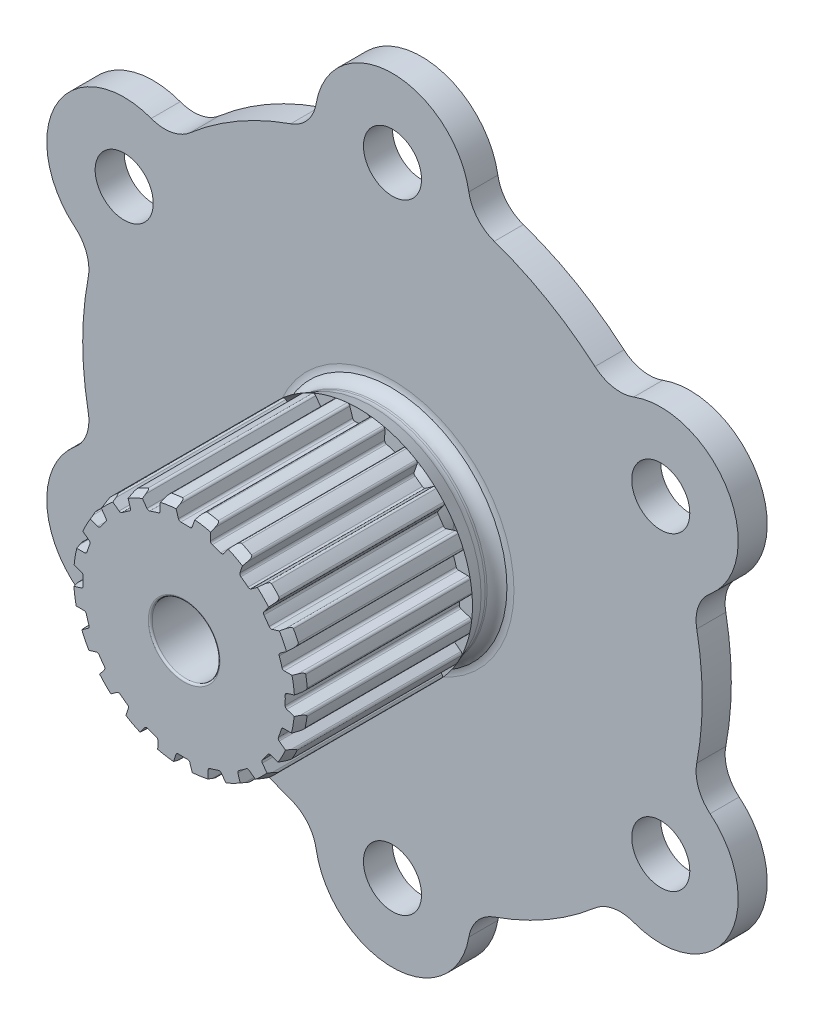
from build123d import *

# Parameters (mm, degrees)
SKETCH1_R           = 3
BOSS_EXTRUDE1_DEPTH = 3
FILLET3_R           = 4
SKETCH13_R          = 23.95
SKETCH13_R_2        = 20.95
BOSS_EXTRUDE8_DEPTH = 4
CHAMFER4_SIZE       = 1
BOSS_EXTRUDE9_DEPTH = 18
SKETCH24_W          = 1
SKETCH24_H          = 1
FILLET5_R           = 0.5
FILLET6_R           = 0.5
FILLET7_R           = 2
SKETCH25_R          = 3.5
CUT_EXTRUDE1_DEPTH  = 61.736209152
FILLET8_R           = 0.2
FILLET9_R           = 1


# Some blends are built 0.0001 mm under size
with BuildPart() as part:
    # Sketch1 → Boss-Extrude1 (new body)
    with BuildSketch(Plane.XY):
        with BuildLine():
            ThreePointArc((-7.937253933, 31), (-16, 27.712812921), (-22.878160551, 22.373863542))
            ThreePointArc((-22.878160551, 22.373863542), (-34.641016151, 20), (-30.815414484, 8.626136458))
            ThreePointArc((-30.815414484, 8.626136458), (-32, 0), (-30.815414484, -8.626136458))
            ThreePointArc((-30.815414484, -8.626136458), (-34.641016151, -20), (-22.878160551, -22.373863542))
            ThreePointArc((-22.878160551, -22.373863542), (-16, -27.712812921), (-7.937253933, -31))
            ThreePointArc((-7.937253933, -31), (0, -40), (7.937253933, -31))
            ThreePointArc((7.937253933, -31), (16, -27.712812921), (22.878160551, -22.373863542))
            ThreePointArc((22.878160551, -22.373863542), (34.641016151, -20), (30.815414484, -8.626136458))
            ThreePointArc((30.815414484, -8.626136458), (32, 0), (30.815414484, 8.626136458))
            ThreePointArc((30.815414484, 8.626136458), (34.641016151, 20), (22.878160551, 22.373863542))
            ThreePointArc((22.878160551, 22.373863542), (16, 27.712812921), (7.937253933, 31))
            ThreePointArc((7.937253933, 31), (0, 40), (-7.937253933, 31))
        make_face()
        with Locations((0, 32)):
            Circle(SKETCH1_R, mode=Mode.SUBTRACT)
        with Locations((27.712812921, 16)):
            Circle(SKETCH1_R, mode=Mode.SUBTRACT)
        with Locations((27.712812921, -16)):
            Circle(SKETCH1_R, mode=Mode.SUBTRACT)
        with Locations((0, -32)):
            Circle(SKETCH1_R, mode=Mode.SUBTRACT)
        with Locations((-27.712812921, -16)):
            Circle(SKETCH1_R, mode=Mode.SUBTRACT)
        with Locations((-27.712812921, 16)):
            Circle(SKETCH1_R, mode=Mode.SUBTRACT)
    extrude(amount=BOSS_EXTRUDE1_DEPTH)

    # Fillet3
    fillet3_edges = [part.edges().sort_by_distance(p)[0] for p in [
        (30.815414484, 8.626136458, 1.5),
        (30.815414484, -8.626136458, 1.5),
        (22.878160551, -22.373863542, 1.5),
        (7.937253933, -31, 1.5),
        (-7.937253933, -31, 1.5),
        (-22.878160551, -22.373863542, 1.5),
        (-30.815414484, -8.626136458, 1.5),
        (-30.815414484, 8.626136458, 1.5),
        (-22.878160551, 22.373863542, 1.5),
        (-7.937253933, 31, 1.5),
        (7.937253933, 31, 1.5),
        (22.878160551, 22.373863542, 1.5),
    ]]
    fillet(fillet3_edges, radius=FILLET3_R)

    # Sketch13 → Boss-Extrude8 (add)
    with BuildSketch(Plane(origin=(0, 0, 0), x_dir=(-1, 0, 0), z_dir=(0, 0, -1))):
        with Locations(Location((0, 0, 0), (0, 0, 180))):
            Circle(SKETCH13_R)
        Circle(SKETCH13_R_2, mode=Mode.SUBTRACT)
    extrude(amount=BOSS_EXTRUDE8_DEPTH)

    # Chamfer4
    chamfer4_edges = [part.edges().sort_by_distance(p)[0] for p in [
        (-23.95, 0, -4),
    ]]
    chamfer(chamfer4_edges, length=CHAMFER4_SIZE)

    # Sketch22 → Revolve1 (revolve)
    with BuildSketch(Plane(origin=(0, 0, 0), x_dir=(0, 0, -1), z_dir=(1, 0, 0)), mode=Mode.PRIVATE) as revolve1_sk:
        with BuildLine():
            Line((-6.521607252, 11.78), (-6.521607252, 0))
            Line((-6.521607252, 0), (-3, 0))
            Line((-3, 0), (-3, 12.099713797))
            Line((-3, 12.099713797), (-3.1, 11.926508716))
            ThreePointArc((-3.1, 11.926508716), (-3.649038106, 11.377470611), (-4.399038106, 11.176508716))
            Line((-4.399038106, 11.176508716), (-4.599038106, 11.176508716))
            ThreePointArc((-4.599038106, 11.176508716), (-4.859510372, 11.199297087), (-5.112068321, 11.266969785))
            Line((-5.112068321, 11.266969785), (-6.521607252, 11.78))
        make_face()
    revolve(revolve1_sk.sketch.rotate(Axis((0, 0, 6.521607252), (0, 0, -1)), 90), axis=Axis((0, 0, 6.521607252), (0, 0, -1)))

    # Sketch23 → Boss-Extrude9 (add)
    with BuildSketch(Plane.XY.offset(6.521607252)):
        with BuildLine():
            Line((1.152037334, 11.522110646), (0.840979736, 10.601581719))
            ThreePointArc((0.840979736, 10.601581719), (0.742588975, 10.472458841), (0.586095184, 10.429294583))
            ThreePointArc((0.586095184, 10.429294583), (0.122277707, 10.445034285), (-0.341781129, 10.440157026))
            ThreePointArc((-0.341781129, 10.440157026), (-0.497221541, 10.486973028), (-0.592562526, 10.618363881))
            Line((-0.592562526, 10.618363881), (-0.881984971, 11.545922496))
            ThreePointArc((-0.881984971, 11.545922496), (-0.984130945, 11.681984497), (-1.14923697, 11.723053568))
            ThreePointArc((-1.14923697, 11.723053568), (-1.706364416, 11.655001117), (-2.259617701, 11.560486945))
            ThreePointArc((-2.259617701, 11.560486945), (-2.406021059, 11.473810969), (-2.464875387, 11.314177526))
            Line((-2.464875387, 11.314177526), (-2.47624966, 10.342580407))
            ThreePointArc((-2.47624966, 10.342580407), (-2.529923671, 10.189372835), (-2.665419621, 10.099961946))
            ThreePointArc((-2.665419621, 10.099961946), (-3.111400091, 9.97160381), (-3.551239115, 9.823563193))
            ThreePointArc((-3.551239115, 9.823563193), (-3.713538672, 9.820054129), (-3.844815343, 9.915552271))
            Line((-3.844815343, 9.915552271), (-4.406703821, 10.708276481))
            ThreePointArc((-4.406703821, 10.708276481), (-4.545895886, 10.806114292), (-4.715612088, 10.794152732))
            ThreePointArc((-4.715612088, 10.794152732), (-5.224442411, 10.557269157), (-5.721411068, 10.29641617))
            ThreePointArc((-5.721411068, 10.29641617), (-5.833864586, 10.168741293), (-5.840508932, 9.998733879))
            Line((-5.840508932, 9.998733879), (-5.551086487, 9.071175265))
            ThreePointArc((-5.551086487, 9.071175265), (-5.554789761, 8.908880023), (-5.656024583, 8.781974663))
            ThreePointArc((-5.656024583, 8.781974663), (-6.04051237, 8.522083276), (-6.413077073, 8.245370551))
            ThreePointArc((-6.413077073, 8.245370551), (-6.566348763, 8.191879911), (-6.720710846, 8.242137319))
            Line((-6.720710846, 8.242137319), (-7.500063797, 8.822429756))
            ThreePointArc((-7.500063797, 8.822429756), (-7.662676864, 8.87246633), (-7.820390238, 8.80864502))
            ThreePointArc((-7.820390238, 8.80864502), (-8.231115583, 8.426118135), (-8.623152856, 8.024460442))
            ThreePointArc((-8.623152856, 8.024460442), (-8.690648801, 7.868284369), (-8.644432769, 7.704544494))
            Line((-8.644432769, 7.704544494), (-8.082544291, 6.911820284))
            ThreePointArc((-8.082544291, 6.911820284), (-8.035914327, 6.756323962), (-8.092978451, 6.604346512))
            ThreePointArc((-8.092978451, 6.604346512), (-8.378337211, 6.238361855), (-8.647158365, 5.86006359))
            ThreePointArc((-8.647158365, 5.86006359), (-8.776398888, 5.761827411), (-8.938736346, 5.76192454))
            Line((-8.938736346, 5.76192454), (-9.859265273, 6.072982137))
            ThreePointArc((-9.859265273, 6.072982137), (-10.029381642, 6.070319545), (-10.159654105, 5.960885759))
            ThreePointArc((-10.159654105, 5.960885759), (-10.432069812, 5.470159961), (-10.680800362, 4.967014615))
            ThreePointArc((-10.680800362, 4.967014615), (-10.69673176, 4.79762495), (-10.602179297, 4.656180614))
            Line((-10.602179297, 4.656180614), (-9.822826346, 4.075888177))
            ThreePointArc((-9.822826346, 4.075888177), (-9.730427609, 3.942411838), (-9.737735201, 3.780238909))
            ThreePointArc((-9.737735201, 3.780238909), (-9.896032031, 3.343986111), (-10.034795548, 2.901132775))
            ThreePointArc((-10.034795548, 2.901132775), (-10.127353941, 2.767767099), (-10.281776052, 2.717694441))
            Line((-10.281776052, 2.717694441), (-11.253373171, 2.729068713))
            ThreePointArc((-11.253373171, 2.729068713), (-11.414340665, 2.673967589), (-11.504420241, 2.529633469))
            ThreePointArc((-11.504420241, 2.529633469), (-11.611860363, 1.978744418), (-11.692936711, 1.423362791))
            ThreePointArc((-11.692936711, 1.423362791), (-11.655744085, 1.257340573), (-11.522110646, 1.152037334))
            Line((-11.522110646, 1.152037334), (-10.601581719, 0.840979736))
            ThreePointArc((-10.601581719, 0.840979736), (-10.472458841, 0.742588975), (-10.429294583, 0.586095184))
            ThreePointArc((-10.429294583, 0.586095184), (-10.445034285, 0.122277707), (-10.440157026, -0.341781129))
            ThreePointArc((-10.440157026, -0.341781129), (-10.486973028, -0.497221541), (-10.618363881, -0.592562526))
            Line((-10.618363881, -0.592562526), (-11.545922496, -0.881984971))
            ThreePointArc((-11.545922496, -0.881984971), (-11.681984497, -0.984130945), (-11.723053568, -1.14923697))
            ThreePointArc((-11.723053568, -1.14923697), (-11.655001117, -1.706364416), (-11.560486945, -2.259617701))
            ThreePointArc((-11.560486945, -2.259617701), (-11.473810969, -2.406021059), (-11.314177526, -2.464875387))
            Line((-11.314177526, -2.464875387), (-10.342580407, -2.47624966))
            ThreePointArc((-10.342580407, -2.47624966), (-10.189372835, -2.529923671), (-10.099961946, -2.665419621))
            ThreePointArc((-10.099961946, -2.665419621), (-9.97160381, -3.111400091), (-9.823563193, -3.551239115))
            ThreePointArc((-9.823563193, -3.551239115), (-9.820054129, -3.713538672), (-9.915552271, -3.844815343))
            Line((-9.915552271, -3.844815343), (-10.708276481, -4.406703821))
            ThreePointArc((-10.708276481, -4.406703821), (-10.806114292, -4.545895886), (-10.794152732, -4.715612088))
            ThreePointArc((-10.794152732, -4.715612088), (-10.557269157, -5.224442411), (-10.29641617, -5.721411068))
            ThreePointArc((-10.29641617, -5.721411068), (-10.168741293, -5.833864586), (-9.998733879, -5.840508932))
            Line((-9.998733879, -5.840508932), (-9.071175265, -5.551086487))
            ThreePointArc((-9.071175265, -5.551086487), (-8.908880023, -5.554789761), (-8.781974663, -5.656024583))
            ThreePointArc((-8.781974663, -5.656024583), (-8.522083276, -6.04051237), (-8.245370551, -6.413077073))
            ThreePointArc((-8.245370551, -6.413077073), (-8.191879911, -6.566348763), (-8.242137319, -6.720710846))
            Line((-8.242137319, -6.720710846), (-8.822429756, -7.500063797))
            ThreePointArc((-8.822429756, -7.500063797), (-8.87246633, -7.662676864), (-8.80864502, -7.820390238))
            ThreePointArc((-8.80864502, -7.820390238), (-8.426118135, -8.231115583), (-8.024460442, -8.623152856))
            ThreePointArc((-8.024460442, -8.623152856), (-7.868284369, -8.690648801), (-7.704544494, -8.644432769))
            Line((-7.704544494, -8.644432769), (-6.911820284, -8.082544291))
            ThreePointArc((-6.911820284, -8.082544291), (-6.756323962, -8.035914327), (-6.604346512, -8.092978451))
            ThreePointArc((-6.604346512, -8.092978451), (-6.238361855, -8.378337211), (-5.86006359, -8.647158365))
            ThreePointArc((-5.86006359, -8.647158365), (-5.761827411, -8.776398888), (-5.76192454, -8.938736346))
            Line((-5.76192454, -8.938736346), (-6.072982137, -9.859265273))
            ThreePointArc((-6.072982137, -9.859265273), (-6.070319545, -10.029381642), (-5.960885759, -10.159654105))
            ThreePointArc((-5.960885759, -10.159654105), (-5.470159961, -10.432069812), (-4.967014615, -10.680800362))
            ThreePointArc((-4.967014615, -10.680800362), (-4.79762495, -10.69673176), (-4.656180614, -10.602179297))
            Line((-4.656180614, -10.602179297), (-4.075888177, -9.822826346))
            ThreePointArc((-4.075888177, -9.822826346), (-3.942411838, -9.730427609), (-3.780238909, -9.737735201))
            ThreePointArc((-3.780238909, -9.737735201), (-3.343986111, -9.896032031), (-2.901132775, -10.034795548))
            ThreePointArc((-2.901132775, -10.034795548), (-2.767767099, -10.127353941), (-2.717694441, -10.281776052))
            Line((-2.717694441, -10.281776052), (-2.729068713, -11.253373171))
            ThreePointArc((-2.729068713, -11.253373171), (-2.673967589, -11.414340665), (-2.529633469, -11.504420241))
            ThreePointArc((-2.529633469, -11.504420241), (-1.978744418, -11.611860363), (-1.423362791, -11.692936711))
            ThreePointArc((-1.423362791, -11.692936711), (-1.257340573, -11.655744085), (-1.152037334, -11.522110646))
            Line((-1.152037334, -11.522110646), (-0.840979736, -10.601581719))
            ThreePointArc((-0.840979736, -10.601581719), (-0.742588975, -10.472458841), (-0.586095184, -10.429294583))
            ThreePointArc((-0.586095184, -10.429294583), (-0.122277707, -10.445034285), (0.341781129, -10.440157026))
            ThreePointArc((0.341781129, -10.440157026), (0.497221541, -10.486973028), (0.592562526, -10.618363881))
            Line((0.592562526, -10.618363881), (0.881984971, -11.545922496))
            ThreePointArc((0.881984971, -11.545922496), (0.984130945, -11.681984497), (1.14923697, -11.723053568))
            ThreePointArc((1.14923697, -11.723053568), (1.706364416, -11.655001117), (2.259617701, -11.560486945))
            ThreePointArc((2.259617701, -11.560486945), (2.406021059, -11.473810969), (2.464875387, -11.314177526))
            Line((2.464875387, -11.314177526), (2.47624966, -10.342580407))
            ThreePointArc((2.47624966, -10.342580407), (2.529923671, -10.189372835), (2.665419621, -10.099961946))
            ThreePointArc((2.665419621, -10.099961946), (3.111400091, -9.97160381), (3.551239115, -9.823563193))
            ThreePointArc((3.551239115, -9.823563193), (3.713538672, -9.820054129), (3.844815343, -9.915552271))
            Line((3.844815343, -9.915552271), (4.406703821, -10.708276481))
            ThreePointArc((4.406703821, -10.708276481), (4.545895886, -10.806114292), (4.715612088, -10.794152732))
            ThreePointArc((4.715612088, -10.794152732), (5.224442411, -10.557269157), (5.721411068, -10.29641617))
            ThreePointArc((5.721411068, -10.29641617), (5.833864586, -10.168741293), (5.840508932, -9.998733879))
            Line((5.840508932, -9.998733879), (5.551086487, -9.071175265))
            ThreePointArc((5.551086487, -9.071175265), (5.554789761, -8.908880023), (5.656024583, -8.781974663))
            ThreePointArc((5.656024583, -8.781974663), (6.04051237, -8.522083276), (6.413077073, -8.245370551))
            ThreePointArc((6.413077073, -8.245370551), (6.566348763, -8.191879911), (6.720710846, -8.242137319))
            Line((6.720710846, -8.242137319), (7.500063797, -8.822429756))
            ThreePointArc((7.500063797, -8.822429756), (7.662676864, -8.87246633), (7.820390238, -8.80864502))
            ThreePointArc((7.820390238, -8.80864502), (8.231115583, -8.426118135), (8.623152856, -8.024460442))
            ThreePointArc((8.623152856, -8.024460442), (8.690648801, -7.868284369), (8.644432769, -7.704544494))
            Line((8.644432769, -7.704544494), (8.082544291, -6.911820284))
            ThreePointArc((8.082544291, -6.911820284), (8.035914327, -6.756323962), (8.092978451, -6.604346512))
            ThreePointArc((8.092978451, -6.604346512), (8.378337211, -6.238361855), (8.647158365, -5.86006359))
            ThreePointArc((8.647158365, -5.86006359), (8.776398888, -5.761827411), (8.938736346, -5.76192454))
            Line((8.938736346, -5.76192454), (9.859265273, -6.072982137))
            ThreePointArc((9.859265273, -6.072982137), (10.029381642, -6.070319545), (10.159654105, -5.960885759))
            ThreePointArc((10.159654105, -5.960885759), (10.432069812, -5.470159961), (10.680800362, -4.967014615))
            ThreePointArc((10.680800362, -4.967014615), (10.69673176, -4.79762495), (10.602179297, -4.656180614))
            Line((10.602179297, -4.656180614), (9.822826346, -4.075888177))
            ThreePointArc((9.822826346, -4.075888177), (9.730427609, -3.942411838), (9.737735201, -3.780238909))
            ThreePointArc((9.737735201, -3.780238909), (9.896032031, -3.343986111), (10.034795548, -2.901132775))
            ThreePointArc((10.034795548, -2.901132775), (10.127353941, -2.767767099), (10.281776052, -2.717694441))
            Line((10.281776052, -2.717694441), (11.253373171, -2.729068713))
            ThreePointArc((11.253373171, -2.729068713), (11.414340665, -2.673967589), (11.504420241, -2.529633469))
            ThreePointArc((11.504420241, -2.529633469), (11.611860363, -1.978744418), (11.692936711, -1.423362791))
            ThreePointArc((11.692936711, -1.423362791), (11.655744085, -1.257340573), (11.522110646, -1.152037334))
            Line((11.522110646, -1.152037334), (10.601581719, -0.840979736))
            ThreePointArc((10.601581719, -0.840979736), (10.472458841, -0.742588975), (10.429294583, -0.586095184))
            ThreePointArc((10.429294583, -0.586095184), (10.445034285, -0.122277707), (10.440157026, 0.341781129))
            ThreePointArc((10.440157026, 0.341781129), (10.486973028, 0.497221541), (10.618363881, 0.592562526))
            Line((10.618363881, 0.592562526), (11.545922496, 0.881984971))
            ThreePointArc((11.545922496, 0.881984971), (11.681984497, 0.984130945), (11.723053568, 1.14923697))
            ThreePointArc((11.723053568, 1.14923697), (11.655001117, 1.706364416), (11.560486945, 2.259617701))
            ThreePointArc((11.560486945, 2.259617701), (11.473810969, 2.406021059), (11.314177526, 2.464875387))
            Line((11.314177526, 2.464875387), (10.342580407, 2.47624966))
            ThreePointArc((10.342580407, 2.47624966), (10.189372835, 2.529923671), (10.099961946, 2.665419621))
            ThreePointArc((10.099961946, 2.665419621), (9.97160381, 3.111400091), (9.823563193, 3.551239115))
            ThreePointArc((9.823563193, 3.551239115), (9.820054129, 3.713538672), (9.915552271, 3.844815343))
            Line((9.915552271, 3.844815343), (10.708276481, 4.406703821))
            ThreePointArc((10.708276481, 4.406703821), (10.806114292, 4.545895886), (10.794152732, 4.715612088))
            ThreePointArc((10.794152732, 4.715612088), (10.557269157, 5.224442411), (10.29641617, 5.721411068))
            ThreePointArc((10.29641617, 5.721411068), (10.168741293, 5.833864586), (9.998733879, 5.840508932))
            Line((9.998733879, 5.840508932), (9.071175265, 5.551086487))
            ThreePointArc((9.071175265, 5.551086487), (8.908880023, 5.554789761), (8.781974663, 5.656024583))
            ThreePointArc((8.781974663, 5.656024583), (8.522083276, 6.04051237), (8.245370551, 6.413077073))
            ThreePointArc((8.245370551, 6.413077073), (8.191879911, 6.566348763), (8.242137319, 6.720710846))
            Line((8.242137319, 6.720710846), (8.822429756, 7.500063797))
            ThreePointArc((8.822429756, 7.500063797), (8.87246633, 7.662676864), (8.80864502, 7.820390238))
            ThreePointArc((8.80864502, 7.820390238), (8.426118135, 8.231115583), (8.024460442, 8.623152856))
            ThreePointArc((8.024460442, 8.623152856), (7.868284369, 8.690648801), (7.704544494, 8.644432769))
            Line((7.704544494, 8.644432769), (6.911820284, 8.082544291))
            ThreePointArc((6.911820284, 8.082544291), (6.756323962, 8.035914327), (6.604346512, 8.092978451))
            ThreePointArc((6.604346512, 8.092978451), (6.238361855, 8.378337211), (5.86006359, 8.647158365))
            ThreePointArc((5.86006359, 8.647158365), (5.761827411, 8.776398888), (5.76192454, 8.938736346))
            Line((5.76192454, 8.938736346), (6.072982137, 9.859265273))
            ThreePointArc((6.072982137, 9.859265273), (6.070319545, 10.029381642), (5.960885759, 10.159654105))
            ThreePointArc((5.960885759, 10.159654105), (5.470159961, 10.432069812), (4.967014615, 10.680800362))
            ThreePointArc((4.967014615, 10.680800362), (4.79762495, 10.69673176), (4.656180614, 10.602179297))
            Line((4.656180614, 10.602179297), (4.075888177, 9.822826346))
            ThreePointArc((4.075888177, 9.822826346), (3.942411838, 9.730427609), (3.780238909, 9.737735201))
            ThreePointArc((3.780238909, 9.737735201), (3.343986111, 9.896032031), (2.901132775, 10.034795548))
            ThreePointArc((2.901132775, 10.034795548), (2.767767099, 10.127353941), (2.717694441, 10.281776052))
            Line((2.717694441, 10.281776052), (2.729068713, 11.253373171))
            ThreePointArc((2.729068713, 11.253373171), (2.673967589, 11.414340665), (2.529633469, 11.504420241))
            ThreePointArc((2.529633469, 11.504420241), (1.978744418, 11.611860363), (1.423362791, 11.692936711))
            ThreePointArc((1.423362791, 11.692936711), (1.257340573, 11.655744085), (1.152037334, 11.522110646))
        make_face()
    extrude(amount=BOSS_EXTRUDE9_DEPTH)

    # Sketch24 → Cut-Revolve1 (revolve, cut)
    with BuildSketch(Plane(origin=(0, 0, 0), x_dir=(1, 0, 0), z_dir=(0, 1, 0)), mode=Mode.PRIVATE) as cut_revolve1_sk:
        with Locations((-23.95, 0)):
            Rectangle(SKETCH24_W, SKETCH24_H)
    revolve(cut_revolve1_sk.sketch.rotate(Axis((0, 0, 0), (0, 0, -1)), 180), axis=Axis((0, 0, 0), (0, 0, -1)), mode=Mode.SUBTRACT)

    # Fillet5
    fillet5_edges = [part.edges().sort_by_distance(p)[0] for p in [
        (-24.45, 0, 0),
        (-23.95, 0, -0.5),
    ]]
    fillet(fillet5_edges, radius=FILLET5_R - 0.0001)  # a hair under: the kernel refuses the full size

    # Fillet6
    fillet6_edges = [part.edges().sort_by_distance(p)[0] for p in [
        (-23.45, 0, -0.5),
        (-24.45, 0, 0.5),
        (-23.45, 0, 0.5),
    ]]
    fillet(fillet6_edges, radius=FILLET6_R)

    # Fillet7
    # the kernel refuses this fillet: 2 mm, written as the material it adds along each edge
    with BuildSketch(Plane(origin=(0, 0, 3), x_dir=(1, 0, 0), z_dir=(0, 1, 0))) as fillet7_piece_1:
        with BuildLine():
            CenterArc((12.551008516, -2), FILLET7_R, 90, 18.194872339)
            Line((11.926508716, -0.1), (11.91401872, -0.062))
            ThreePointArc((11.91401872, -0.062), (11.993111257, -0.015358984), (12.079713797, 0.034641016))
            Line((12.079713797, 0.034641016), (12.099713797, 0.04))
            Line((12.099713797, 0.04), (12.551008516, 0.04))
            Line((12.551008516, 0.04), (12.551008516, 0))
        make_face()
    revolve(axis=Axis((0, 0, 3), (0, 0, -1)))

    # Sketch25 → Cut-Extrude1 (cut, through all)
    with BuildSketch(Plane.XY.offset(24.521607252)):
        Circle(SKETCH25_R)
    extrude(amount=-CUT_EXTRUDE1_DEPTH, mode=Mode.SUBTRACT)

    # Fillet8
    fillet8_edges = [part.edges().sort_by_distance(p)[0] for p in [
        (-3.5, 0, 0),
        (-3.5, 0, 24.521607252),
    ]]
    fillet(fillet8_edges, radius=FILLET8_R)

    # Sketch27 → Cut-Revolve4 (revolve, cut)
    with BuildSketch(Plane(origin=(0, 0, 0), x_dir=(0, 0, 1), z_dir=(-0.989451885075621, -0.14486188981336745, 0)), mode=Mode.PRIVATE) as cut_revolve4_sk:
        Polygon((23.521607252, 11.779878091), (24.521607252, 11.779878091), (24.521607252, 11.415907856), align=None)
    revolve(cut_revolve4_sk.sketch.rotate(Axis((0, 0, 25.646521916), (0, 0, 1)), 261.670718382), axis=Axis((0, 0, 25.646521916), (0, 0, 1)), mode=Mode.SUBTRACT)

    # Fillet9
    fillet9_edges = [part.edges().sort_by_distance(p)[0] for p in [
        (20.95, 0, 0),
    ]]
    fillet(fillet9_edges, radius=FILLET9_R)


solid = part.part
